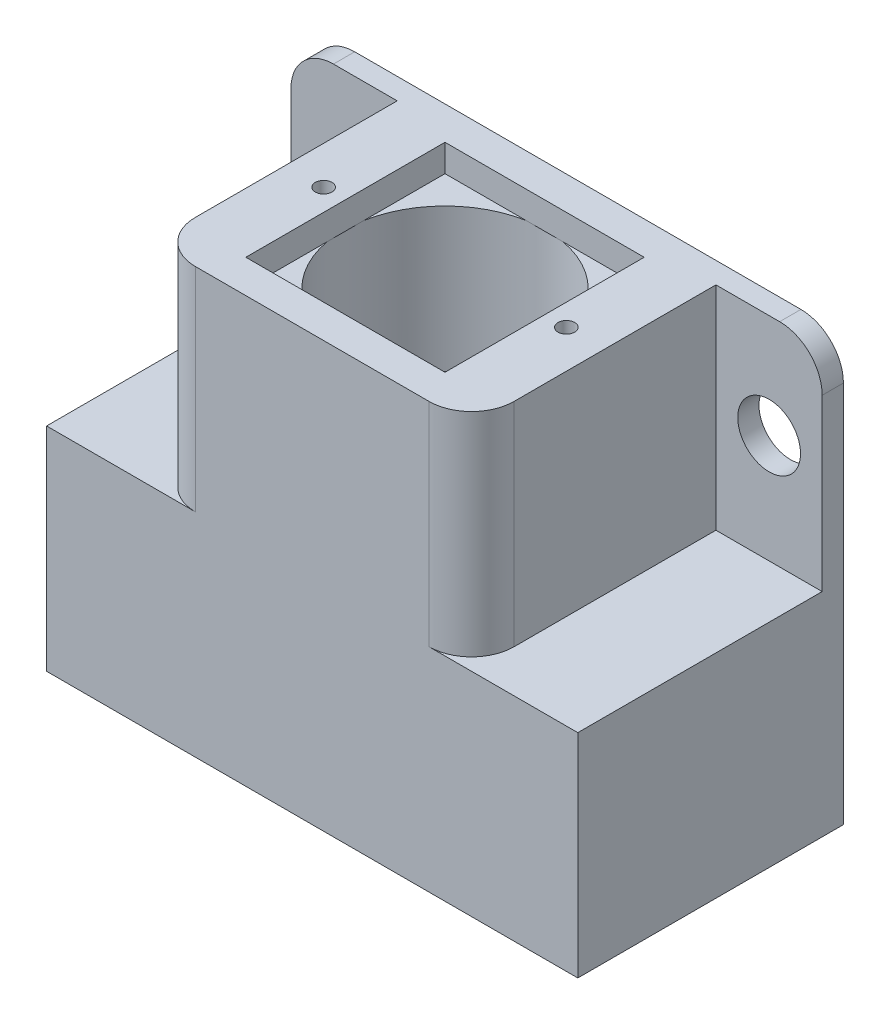
from build123d import *

# Parameters (mm, degrees)
BOSS_EXTRUDE1_START          = -25.4
BOSS_EXTRUDE1_OUTLINE_W      = 63.5
BOSS_EXTRUDE1_OUTLINE_H      = 31.75
BOSS_EXTRUDE1_DEPTH          = 50.8
SKETCH2_W                    = 12.7
SKETCH2_H                    = 29.21
CUT_EXTRUDE1_DEPTH           = 25.4
SKETCH3_W                    = 12.7
SKETCH3_H                    = 29.21
CUT_EXTRUDE2_DEPTH           = 25.4
SKETCH4_W                    = 23.809600622
SKETCH4_H                    = 23.809600622
CUT_EXTRUDE3_DEPTH           = 3.25
SKETCH5_W                    = 12.108
SKETCH5_H                    = 47.55
F_2_0_2_DIAMETER_HOLE1_D     = 2
F_2_0_2_DIAMETER_HOLE1_DEPTH = 2.54
M7_CLEARANCE_HOLE1_D         = 7.508
M7_CLEARANCE_HOLE1_DEPTH     = 31.75
FILLET1_R                    = 5.08


with BuildPart() as part:
    # Boss-Extrude1: read off the stored shape, not the designer's step
    # Boss-Extrude1 outline → Boss-Extrude1 (new body)
    with BuildSketch(Plane.XZ.offset(25.4).offset(BOSS_EXTRUDE1_START)):
        Rectangle(BOSS_EXTRUDE1_OUTLINE_W, BOSS_EXTRUDE1_OUTLINE_H)
    extrude(amount=BOSS_EXTRUDE1_DEPTH)

    # Sketch2 → Cut-Extrude1 (cut)
    with BuildSketch(Plane(origin=(0, 0, 0), x_dir=(-1, 0, 0), z_dir=(0, 1, 0))):
        with Locations((-25.4, 1.27)):
            Rectangle(SKETCH2_W, SKETCH2_H)
    extrude(amount=-CUT_EXTRUDE1_DEPTH, mode=Mode.SUBTRACT)

    # Sketch3 → Cut-Extrude2 (cut)
    with BuildSketch(Plane(origin=(0, 0, 0), x_dir=(-1, 0, 0), z_dir=(0, 1, 0))):
        with Locations((25.4, 1.27)):
            Rectangle(SKETCH3_W, SKETCH3_H)
    extrude(amount=-CUT_EXTRUDE2_DEPTH, mode=Mode.SUBTRACT)

    # Sketch4 → Cut-Extrude3 (cut)
    with BuildSketch(Plane(origin=(0, 0, 0), x_dir=(-1, 0, 0), z_dir=(0, 1, 0))):
        Rectangle(SKETCH4_W, SKETCH4_H)
    extrude(amount=-CUT_EXTRUDE3_DEPTH, mode=Mode.SUBTRACT)

    # Sketch5 → M22 Clearance Hole1 (revolve, cut)
    with BuildSketch(Plane(origin=(0, -3.25, 0), x_dir=(0, 0, 1), z_dir=(1, 0, 0))):
        with Locations((6.054, 23.775)):
            Rectangle(SKETCH5_W, SKETCH5_H)
    revolve(axis=Axis((0, 3.1, 0), (0, -1, 0)), mode=Mode.SUBTRACT)

    # Ø2.0 (2) Diameter Hole1
    with Locations(Plane(origin=(0, 0, 0), x_dir=(1, 0, 0), z_dir=(0, 1, 0))):
        with Locations((14.5034, 0), (-14.5034, 0)):
            Hole(F_2_0_2_DIAMETER_HOLE1_D / 2, depth=F_2_0_2_DIAMETER_HOLE1_DEPTH)

    # M7 Clearance Hole1
    with Locations(Plane(origin=(0, 0, -15.875), x_dir=(-1, 0, 0), z_dir=(0, 0, -1))):
        with Locations((25.412960945, -12.423554609), (-25.412960945, -12.423554609)):
            Hole(M7_CLEARANCE_HOLE1_D / 2, depth=M7_CLEARANCE_HOLE1_DEPTH)

    # Fillet1
    fillet1_edges = [part.edges().sort_by_distance(p)[0] for p in [
        (19.05, -12.7, 15.875),
        (-19.05, -12.7, 15.875),
        (-31.75, 0, -14.605),
        (31.75, 0, -14.605),
    ]]
    fillet(fillet1_edges, radius=FILLET1_R)


solid = part.part
